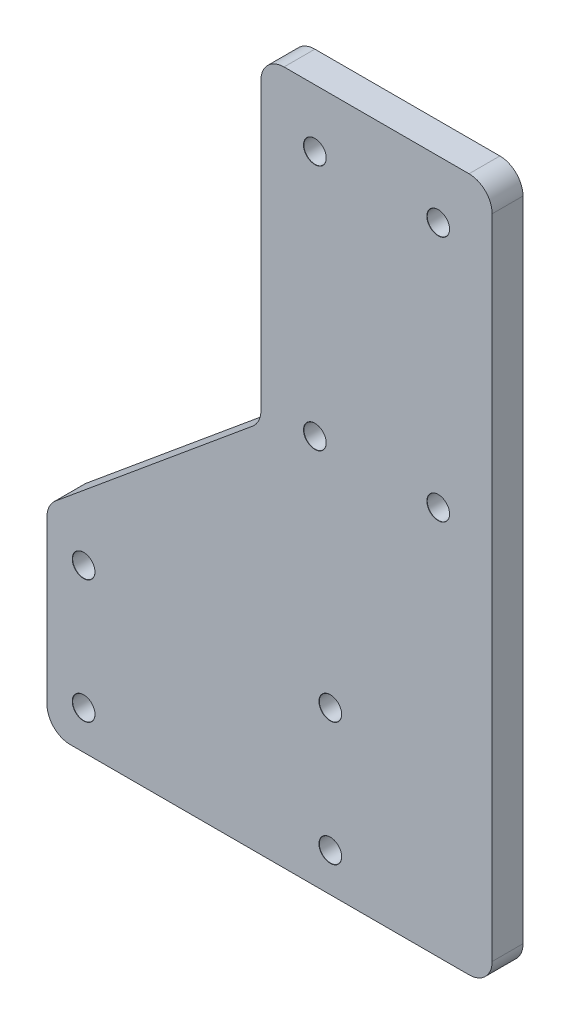
from build123d import *

# Parameters (mm, degrees)
EXTRUDE_1_DEPTH                = 4
HOLE_WIZARD_M2_5_1_D           = 2.9
HOLE_WIZARD_M2_5_1_CSINK_D     = 2.95
HOLE_WIZARD_M2_5_1_CSINK_ANGLE = 90
FILLET_2_R                     = 3


with BuildPart() as part:
    # 草图1 → 凸台-拉伸1 (new body)
    with BuildSketch(Plane.XY):
        Polygon((0, 0), (-41.5, 0), (-41.5, 25.5), (-13.75, 48.5), (-13.75, 90), (16.25, 90), (16.25, 0), align=None)
    extrude(amount=EXTRUDE_1_DEPTH)

    # M2.5 间隙孔1 (through all)
    with Locations(Plane.XY.offset(4)):
        with Locations((9.25, 50.5), (-36.75, 5), (-36.75, 21), (-4.75, 5), (-4.75, 21), (-6.75, 82.5), (9.25, 82.5), (-6.75, 50.5)):
            CounterSinkHole(HOLE_WIZARD_M2_5_1_D / 2, HOLE_WIZARD_M2_5_1_CSINK_D / 2, counter_sink_angle=HOLE_WIZARD_M2_5_1_CSINK_ANGLE)

    # 圆角2
    fillet_2_edges = [part.edges().sort_by_distance(p)[0] for p in [
        (16.25, 0, 2),
        (-41.5, 0, 2),
        (-41.5, 25.5, 2),
        (-13.75, 48.5, 2),
        (-13.75, 90, 2),
        (16.25, 90, 2),
    ]]
    fillet(fillet_2_edges, radius=FILLET_2_R)


solid = part.part
